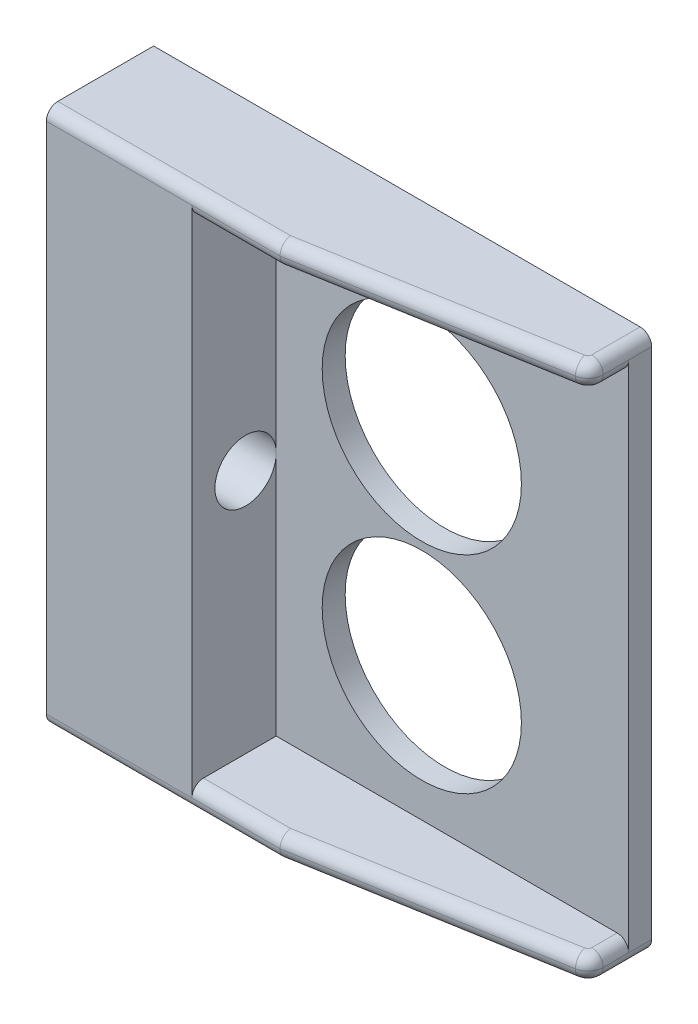
from build123d import *

# Parameters (mm, degrees)
SKETCH1_W                       = 65
SKETCH1_H                       = 70
BOSS_EXTRUDE1_DEPTH             = 3
BOSS_EXTRUDE2_DEPTH             = 3
LPATTERN1_COUNT                 = 2
LPATTERN1_PITCH                 = 67
BOSS_EXTRUDE3_REACH             = 77.771
SKETCH4_W                       = 19
SKETCH4_H                       = 11
FILLET4_R                       = 2
FILLET3_R                       = 1.5
F_8_0MM_DOWEL_HOLE1_D           = 8
F_8_0MM_DOWEL_HOLE1_CSINK_D     = 8.05
F_8_0MM_DOWEL_HOLE1_CSINK_ANGLE = 90
F_1_0_26_DIAMETER_HOLE1_D       = 26
LPATTERN2_COUNT                 = 2
LPATTERN2_PITCH                 = 27


with BuildPart() as part:
    # Sketch1 → Boss-Extrude1 (new body)
    with BuildSketch(Plane.XY):
        Rectangle(SKETCH1_W, SKETCH1_H)
    extrude(amount=BOSS_EXTRUDE1_DEPTH)

    # Sketch2 → Boss-Extrude2 (add)
    with BuildSketch(Plane(origin=(-2.5, 35, 0), x_dir=(0, 0, -1), z_dir=(0, 1, 0))):
        Polygon((-14, -0.5), (-14, 30), (-3, 30), (-3, -35), (-8, -35), align=None)
    boss_extrude2 = extrude(amount=-BOSS_EXTRUDE2_DEPTH)

    # LPattern1: Boss-Extrude2 ×2
    with Locations(*[(0, -i * LPATTERN1_PITCH, 0) for i in range(1, LPATTERN1_COUNT)]):
        add(boss_extrude2)

    # Sketch4 → Boss-Extrude3 (add, up to next)
    with BuildSketch(Plane.XZ.offset(-32), mode=Mode.PRIVATE) as boss_extrude3_sk1:
        with Locations((-23, 8.5)):
            Rectangle(SKETCH4_W, SKETCH4_H)
    boss_extrude3_tool1 = extrude(boss_extrude3_sk1.sketch, amount=BOSS_EXTRUDE3_REACH, mode=Mode.PRIVATE) - part.part
    add(boss_extrude3_tool1.solids().sort_by_distance((-23, 32, 8.5))[0])

    # Fillet4
    fillet4_edges = [part.edges().sort_by_distance(p)[0] for p in [
        (32.5, 33.5, 8),
        (32.5, -33.5, 8),
    ]]
    fillet(fillet4_edges, radius=FILLET4_R)

    # Fillet3
    fillet3_edges = [part.edges().sort_by_distance(p)[0] for p in [
        (14.421341175, 32, 11.144114578),
        (14.421341175, 35, 11.144114578),
        (-17.25, 35, 14),
        (-7.75, 32, 14),
        (14.421341175, -32, 11.144114578),
        (-7.75, -32, 14),
        (-17.25, -35, 14),
        (14.421341175, -35, 11.144114578),
        (32.5, 32, 4.658902823),
        (32.030582356, 32, 7.605174145),
        (32.5, 35, 3.158902823),
        (32.030582356, 35, 7.605174145),
        (32.5, -32, 4.658902823),
        (32.030582356, -32, 7.605174145),
        (32.5, -35, 3.158902823),
        (32.030582356, -35, 7.605174145),
    ]]
    fillet(fillet3_edges, radius=FILLET3_R - 0.0001)  # a hair under: the kernel refuses the full size

    # Ø8.0mm Dowel Hole1 (through all)
    with Locations(Plane.ZY.offset(32.5)):
        with Locations((7, 0)):
            CounterSinkHole(F_8_0MM_DOWEL_HOLE1_D / 2, F_8_0MM_DOWEL_HOLE1_CSINK_D / 2, counter_sink_angle=F_8_0MM_DOWEL_HOLE1_CSINK_ANGLE)

    # Ø1.0 (26) Diameter Hole1 (through all)
    with Locations(Plane.XY.offset(3)):
        with Locations((5.5, -14.5)):
            f_1_0_26_diameter_hole1 = Hole(F_1_0_26_DIAMETER_HOLE1_D / 2)

    # LPattern2: Ø1.0 (26) Diameter Hole1 ×2
    with Locations(*[(0, i * LPATTERN2_PITCH, 0) for i in range(1, LPATTERN2_COUNT)]):
        add(f_1_0_26_diameter_hole1, mode=Mode.SUBTRACT)


solid = part.part
